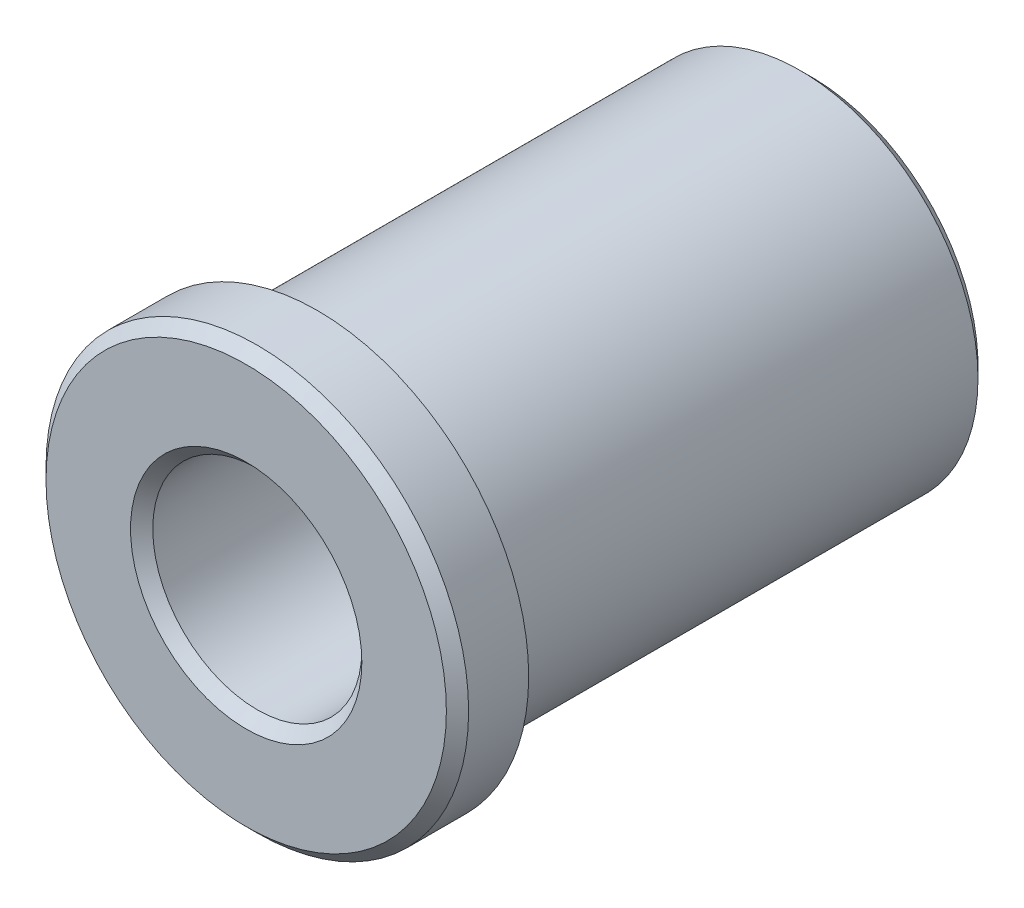
from build123d import *

# Parameters (mm, degrees)
CHAMFER1_SIZE = 0.25


with BuildPart() as part:
    # Sketch6 → Revolve1 (revolve)
    with BuildSketch(Plane(origin=(0, 0, 0), x_dir=(1, 0, 0), z_dir=(0, 1, 0))):
        Polygon((2.35, 0), (4.75, 0), (4.75, 1.6), (4, 1.6), (4, 12.7), (2.35, 12.7), align=None)
    revolve(axis=Axis((0, 0, 0), (0, 0, -1)))

    # Chamfer1
    chamfer1_edges = [part.edges().sort_by_distance(p)[0] for p in [
        (-2.35, 0, 0),
        (-4.75, 0, 0),
        (-4, 0, -12.7),
        (-2.35, 0, -12.7),
    ]]
    chamfer(chamfer1_edges, length=CHAMFER1_SIZE)


solid = part.part
